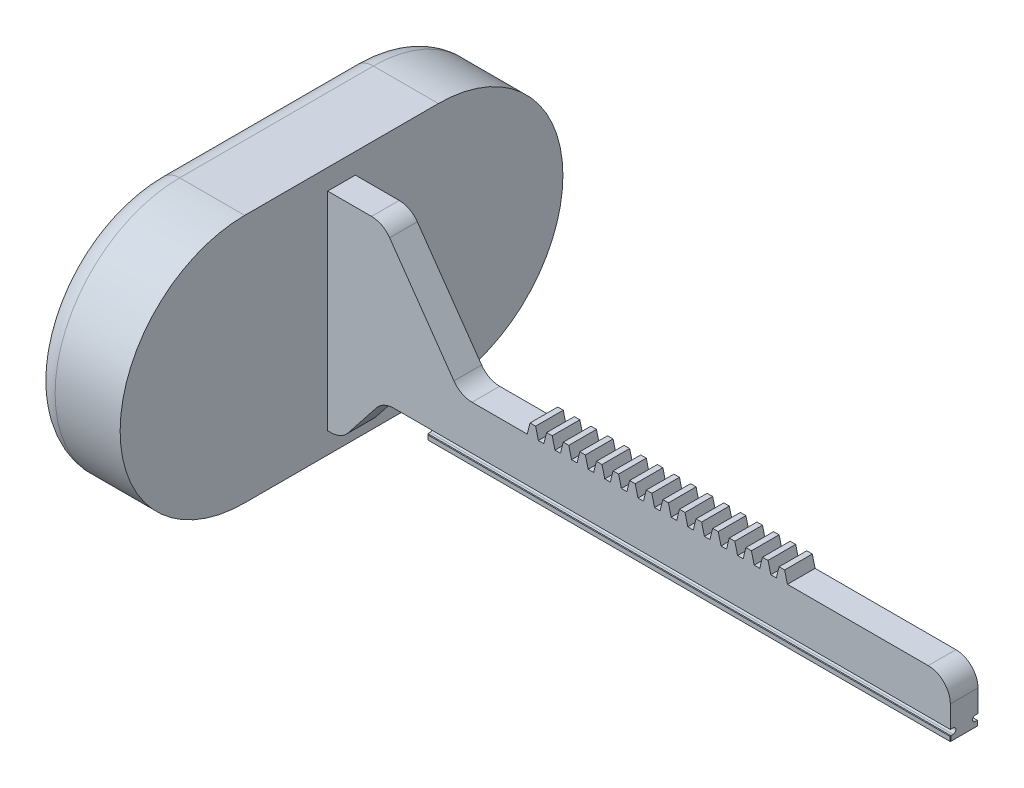
from build123d import *

# Parameters (mm, degrees)
BOSS_EXTRUDE1_DEPTH = 6.35
FILLET1_R           = 5.08
FILLET2_R           = 5.08
FILLET3_R           = 5.08
SKETCH2_W           = 1.27
SKETCH2_H           = 1.27
CUT_EXTRUDE1_DEPTH  = 120.015
FILLET5_R           = 0.635
FILLET6_R           = 0.635
CHAMFER1_SIZE       = 0.127
BOSS_EXTRUDE2_DEPTH = 6.35
SKETCH4_W           = 101.6
SKETCH4_H           = 57.15
BOSS_EXTRUDE3_DEPTH = 20
FILLET7_RADIUS      = 28.575
FILLET7_LENGTH      = 20
FILLET8_RADIUS      = 28.575
FILLET8_LENGTH      = 20
FILLET9_R           = 5.08


with BuildPart() as part:
    # Sketch1 → Boss-Extrude1 (new body)
    with BuildSketch(Plane.XY):
        Polygon((-71.4375, 23.8125), (-58.7375, 23.8125), (-40.9575, -1.5875), (71.4375, -1.5875), (71.4375, -14.2875), (-48.5775, -14.2875), (-48.5775, -11.7475), (-58.7375, -11.7475), (-68.2625, -23.8125), (-71.4375, -23.8125), align=None)
    extrude(amount=BOSS_EXTRUDE1_DEPTH)

    # Fillet1
    fillet1_edges = [part.edges().sort_by_distance(p)[0] for p in [
        (-58.7375, 23.8125, 3.175),
    ]]
    fillet(fillet1_edges, radius=FILLET1_R)

    # Fillet2
    fillet2_edges = [part.edges().sort_by_distance(p)[0] for p in [
        (-40.9575, -1.5875, 3.175),
        (-58.7375, -11.7475, 3.175),
        (-68.2625, -23.8125, 3.175),
    ]]
    fillet(fillet2_edges, radius=FILLET2_R)

    # Fillet3
    fillet3_edges = [part.edges().sort_by_distance(p)[0] for p in [
        (71.4375, -1.5875, 3.175),
    ]]
    fillet(fillet3_edges, radius=FILLET3_R)

    # Sketch2 → Cut-Extrude1 (cut)
    with BuildSketch(Plane(origin=(71.4375, 0, 0), x_dir=(0, 0, -1), z_dir=(1, 0, 0))):
        with Locations((-5.715, -12.3825)):
            Rectangle(SKETCH2_W, SKETCH2_H)
        with Locations((-0.635, -12.3825)):
            Rectangle(SKETCH2_W, SKETCH2_H)
    extrude(amount=-CUT_EXTRUDE1_DEPTH, mode=Mode.SUBTRACT)

    # Fillet5
    fillet5_edges = [part.edges().sort_by_distance(p)[0] for p in [
        (11.43, -11.7475, 1.27),
        (11.43, -13.0175, 1.27),
    ]]
    fillet(fillet5_edges, radius=FILLET5_R - 0.0001)  # a hair under: the kernel refuses the full size

    # Fillet6
    fillet6_edges = [part.edges().sort_by_distance(p)[0] for p in [
        (11.43, -11.7475, 5.08),
        (11.43, -13.0175, 5.08),
    ]]
    fillet(fillet6_edges, radius=FILLET6_R - 0.0001)  # a hair under: the kernel refuses the full size

    # Chamfer1
    chamfer1_edges = [part.edges().sort_by_distance(p)[0] for p in [
        (71.4375, -13.6525, 0),
        (11.43, -14.2875, 0),
        (71.4375, -14.2875, 3.175),
        (11.43, -14.2875, 6.35),
        (71.4375, -13.6525, 6.35),
        (-48.5775, -13.6525, 0),
        (-48.5775, -13.6525, 6.35),
        (11.43, -13.0175, 6.35),
        (11.43, -13.0175, 0),
    ]]
    chamfer(chamfer1_edges, length=CHAMFER1_SIZE)

    # Sketch3 → Boss-Extrude2 (add)
    with BuildSketch(Plane.XY.offset(6.35)):
        Polygon((-18.01675216, -1.5875), (-15.47675216, -1.5875), (-16.11175216, 0.9525), (-17.38175216, 0.9525), align=None)
        Polygon((5.47824784, 0.9525), (4.84324784, -1.5875), (7.38324784, -1.5875), (6.74824784, 0.9525), align=None)
        Polygon((-25.63675216, -1.5875), (-25.00175216, 0.9525), (-23.73175216, 0.9525), (-23.09675216, -1.5875), align=None)
        Polygon((-21.82675216, -1.5875), (-21.19175216, 0.9525), (-19.92175216, 0.9525), (-19.28675216, -1.5875), align=None)
        Polygon((-12.30175216, 0.9525), (-11.66675216, -1.5875), (-14.20675216, -1.5875), (-13.57175216, 0.9525), align=None)
        Polygon((-8.49175216, 0.9525), (-7.85675216, -1.5875), (-10.39675216, -1.5875), (-9.76175216, 0.9525), align=None)
        Polygon((-4.68175216, 0.9525), (-4.04675216, -1.5875), (-6.58675216, -1.5875), (-5.95175216, 0.9525), align=None)
        Polygon((-2.77675216, -1.5875), (-2.14175216, 0.9525), (-0.87175216, 0.9525), (-0.23675216, -1.5875), align=None)
        Polygon((2.93824784, 0.9525), (3.57324784, -1.5875), (1.03324784, -1.5875), (1.66824784, 0.9525), align=None)
        Polygon((10.55824784, 0.9525), (11.19324784, -1.5875), (8.65324784, -1.5875), (9.28824784, 0.9525), align=None)
        Polygon((14.36824784, 0.9525), (15.00324784, -1.5875), (12.46324784, -1.5875), (13.09824784, 0.9525), align=None)
        Polygon((18.17824784, 0.9525), (18.81324784, -1.5875), (16.27324784, -1.5875), (16.90824784, 0.9525), align=None)
        Polygon((21.98824784, 0.9525), (22.62324784, -1.5875), (20.08324784, -1.5875), (20.71824784, 0.9525), align=None)
        Polygon((25.79824784, 0.9525), (26.43324784, -1.5875), (23.89324784, -1.5875), (24.52824784, 0.9525), align=None)
        Polygon((27.70324784, -1.5875), (28.33824784, 0.9525), (29.60824784, 0.9525), (30.24324784, -1.5875), align=None)
        Polygon((33.41824784, 0.9525), (34.05324784, -1.5875), (31.51324784, -1.5875), (32.14824784, 0.9525), align=None)
    extrude(amount=-BOSS_EXTRUDE2_DEPTH)


with BuildPart() as body_2:
    # Sketch4 → Boss-Extrude3 (new body)
    with BuildSketch(Plane.ZY.offset(71.4375)):
        with Locations((3.175, -0.0635)):
            Rectangle(SKETCH4_W, SKETCH4_H)
    extrude(amount=BOSS_EXTRUDE3_DEPTH)

    # Fillet7: full round fillet: the end face becomes a half cylinder, R = half its width
    fillet7_face = Plane((-81.4375, -0.0635, -47.625), x_dir=(-1, 0, 0), z_dir=(0, 0, -1))  # on the end face: x along it, z out of the body
    fillet7_slab = fillet7_face.offset(-FILLET7_RADIUS / 2) * Box(FILLET7_LENGTH, 2 * FILLET7_RADIUS, FILLET7_RADIUS, mode=Mode.PRIVATE)  # the body's end, R deep
    fillet7_round = Plane((-81.4375, -0.0635, -19.05), x_dir=(0, 0, -1), z_dir=(-1, 0, 0)) * Cylinder(FILLET7_RADIUS, FILLET7_LENGTH, mode=Mode.PRIVATE)  # its axis R under the face
    add(fillet7_slab - fillet7_round, mode=Mode.SUBTRACT)

    # Fillet8: full round fillet: the end face becomes a half cylinder, R = half its width
    fillet8_face = Plane((-81.4375, -0.0635, 53.975), x_dir=(1, 0, 0), z_dir=(0, 0, 1))  # on the end face: x along it, z out of the body
    fillet8_slab = fillet8_face.offset(-FILLET8_RADIUS / 2) * Box(FILLET8_LENGTH, 2 * FILLET8_RADIUS, FILLET8_RADIUS, mode=Mode.PRIVATE)  # the body's end, R deep
    fillet8_round = Plane((-81.4375, -0.0635, 25.4), x_dir=(0, 0, 1), z_dir=(1, 0, 0)) * Cylinder(FILLET8_RADIUS, FILLET8_LENGTH, mode=Mode.PRIVATE)  # its axis R under the face
    add(fillet8_slab - fillet8_round, mode=Mode.SUBTRACT)

    # Fillet9
    fillet9_edges = [body_2.edges().sort_by_distance(p)[0] for p in [
        (-91.4375, -28.6385, 3.175),
        (-91.4375, -0.0635, -47.625),
        (-91.4375, 28.5115, 3.175),
        (-91.4375, -0.0635, 53.975),
    ]]
    fillet(fillet9_edges, radius=FILLET9_R)


solid = Compound([part.part, body_2.part])
